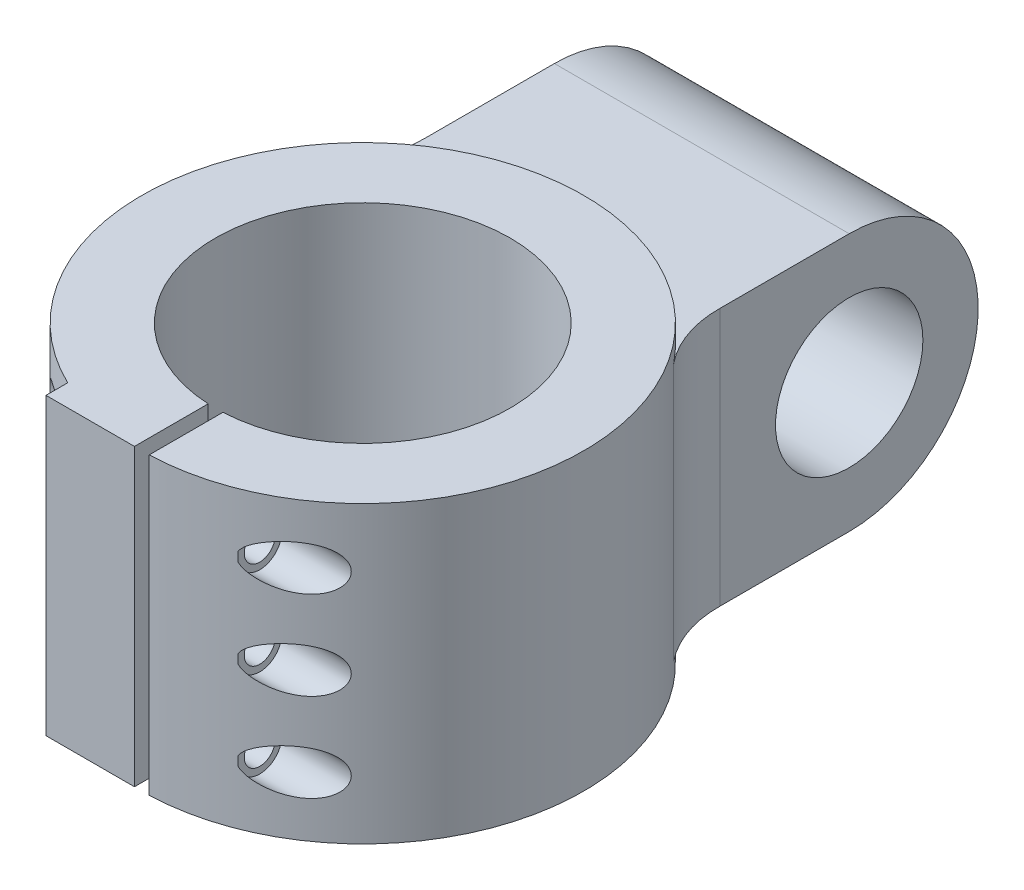
from build123d import *

# Parameters (mm, degrees)
SKETCH1_R                                    = 30
SKETCH1_R_2                                  = 20
BOSS_EXTRUDE1_DEPTH                          = 40
SKETCH2_W                                    = 2
SKETCH2_H                                    = 30
CUT_EXTRUDE1_DEPTH                           = 59.309518948
BOSS_EXTRUDE2_START                          = -40
BOSS_EXTRUDE2_DEPTH                          = 40
CBORE_FOR_M4_HEX_SOCKET_HEAD_CAP_SCR_2_COUNT = 2
CBORE_FOR_M4_HEX_SOCKET_HEAD_CAP_SCR_2_PITCH = 12
CBORE_FOR_M4_HEX_SOCKET_HEAD_CAP_SCR_3_COUNT = 2
CBORE_FOR_M4_HEX_SOCKET_HEAD_CAP_SCR_3_PITCH = 24
SKETCH6_R                                    = 3.75
CUT_EXTRUDE2_DEPTH                           = 66.946948375
F_5_4_5_4_DIAMETER_HOLE1_D                   = 4.2
SKETCH10_R                                   = 3
CUT_EXTRUDE3_DEPTH                           = 11
BOSS_EXTRUDE4_DEPTH                          = 20
BOSS_EXTRUDE4_DEPTH_BACK                     = 20
SKETCH13_R                                   = 17.5
SKETCH13_R_2                                 = 10
FILLET1_R                                    = 15


with BuildPart() as part:
    # Sketch1 → Boss-Extrude1 (new body)
    with BuildSketch(Plane(origin=(0, 0, 0), x_dir=(1, 0, 0), z_dir=(0, 1, 0))):
        with Locations(Location((0, 0, 0), (0, 0, 270))):
            Circle(SKETCH1_R)
        with Locations(Location((0, 0, 0), (0, 0, 270))):
            Circle(SKETCH1_R_2, mode=Mode.SUBTRACT)
    extrude(amount=BOSS_EXTRUDE1_DEPTH)

    # Sketch2 → Cut-Extrude1 (cut, through all)
    with BuildSketch(Plane(origin=(0, 40, 0), x_dir=(1, 0, 0), z_dir=(0, 1, 0))):
        with Locations((0, -15)):
            Rectangle(SKETCH2_W, SKETCH2_H)
    extrude(amount=-CUT_EXTRUDE1_DEPTH, mode=Mode.SUBTRACT)

    # Sketch3 → Boss-Extrude2 (add)
    with BuildSketch(Plane(origin=(0, 40, 0), x_dir=(1, 0, 0), z_dir=(0, 1, 0)).offset(BOSS_EXTRUDE2_START)):
        with BuildLine():
            Line((-1, -29.983328701), (-13, -29.983328701))
            Line((-13, -29.983328701), (-13, -27.037011669))
            ThreePointArc((-13, -27.037011669), (-7.153334608, -29.134683866), (-1, -29.983328701))
        make_face()
    extrude(amount=BOSS_EXTRUDE2_DEPTH)

    # Sketch5 → CBORE for M4 Hex Socket Head Cap Screw1 (revolve, cut)
    with BuildSketch(Plane(origin=(-13, 32, 24.979156528), x_dir=(0, 0, 1), z_dir=(0, 1, 0))):
        Polygon((0, 0), (0, 13.351936393), (2.25, 12), (2.25, 4), (3.75, 4), (3.75, 0), align=None)
    cbore_for_m4_hex_socket_head_cap_screw1 = revolve(axis=Axis((-19.35, 32, 24.979156528), (1, 0, 0)), mode=Mode.SUBTRACT)

    # CBORE for M4 Hex Socket Head Cap Scr 2: CBORE for M4 Hex Socket Head Cap Screw1 ×2
    with Locations(*[(0, -i * CBORE_FOR_M4_HEX_SOCKET_HEAD_CAP_SCR_2_PITCH, 0) for i in range(1, CBORE_FOR_M4_HEX_SOCKET_HEAD_CAP_SCR_2_COUNT)]):
        add(cbore_for_m4_hex_socket_head_cap_screw1, mode=Mode.SUBTRACT)

    # CBORE for M4 Hex Socket Head Cap Scr 3: CBORE for M4 Hex Socket Head Cap Screw1 ×2
    with Locations(*[(0, -i * CBORE_FOR_M4_HEX_SOCKET_HEAD_CAP_SCR_3_PITCH, 0) for i in range(1, CBORE_FOR_M4_HEX_SOCKET_HEAD_CAP_SCR_3_COUNT)]):
        add(cbore_for_m4_hex_socket_head_cap_screw1, mode=Mode.SUBTRACT)

    # Sketch6 → Cut-Extrude2 (cut, through all)
    with BuildSketch(Plane.ZY.offset(13)):
        with Locations((24.979156528, 32)):
            Circle(SKETCH6_R)
        with Locations((24.979156528, 20)):
            Circle(SKETCH6_R)
        with Locations((24.979156528, 8)):
            Circle(SKETCH6_R)
    extrude(amount=CUT_EXTRUDE2_DEPTH, mode=Mode.SUBTRACT)

    # Ø5.4 (5.4) Diameter Hole1 (through all)
    with Locations(Plane.ZY.offset(-1)):
        with Locations((24.979156528, 8), (24.979156528, 20), (24.979156528, 32)):
            Hole(F_5_4_5_4_DIAMETER_HOLE1_D / 2)

    # Sketch10 → Cut-Extrude3 (cut)
    with BuildSketch(Plane.ZY.offset(-22)):
        with Locations((24.979156528, 8)):
            Circle(SKETCH10_R)
        with Locations((24.979156528, 32)):
            Circle(SKETCH10_R)
        with Locations((24.979156528, 20)):
            Circle(SKETCH10_R)
    extrude(amount=CUT_EXTRUDE3_DEPTH, mode=Mode.SUBTRACT)

    # Sketch13 → Boss-Extrude4 (add, two sides: drawn at the far end of the back side and taken through both)
    # profile 1 of 3: a face of its own
    with BuildSketch(Plane(origin=(0, 0, 0), x_dir=(0, 0, -1), z_dir=(1, 0, 0)).offset(-BOSS_EXTRUDE4_DEPTH_BACK)):
        with BuildLine():
            ThreePointArc((28.5, 20), (33.625631329, 32.374368671), (46, 37.5))
            Line((46, 37.5), (30, 37.5))
            Line((30, 37.5), (28.5, 37.5))
            Line((28.5, 37.5), (28.5, 20))
        make_face()
    # profile 2 of 3: a face of its own
    with BuildSketch(Plane(origin=(0, 0, 0), x_dir=(0, 0, -1), z_dir=(1, 0, 0)).offset(-BOSS_EXTRUDE4_DEPTH_BACK)):
        with BuildLine():
            ThreePointArc((46, 2.5), (33.625631329, 7.625631329), (28.5, 20))
            Line((28.5, 20), (28.5, 2.5))
            Line((28.5, 2.5), (30, 2.5))
            Line((30, 2.5), (46, 2.5))
        make_face()
    # profile 3 of 3: a face of its own
    with BuildSketch(Plane(origin=(0, 0, 0), x_dir=(0, 0, -1), z_dir=(1, 0, 0)).offset(-BOSS_EXTRUDE4_DEPTH_BACK)):
        with Locations((46, 20)):
            Circle(SKETCH13_R)
        with Locations((46, 20)):
            Circle(SKETCH13_R_2, mode=Mode.SUBTRACT)
    extrude(amount=BOSS_EXTRUDE4_DEPTH + BOSS_EXTRUDE4_DEPTH_BACK)

    # Fillet1
    # the kernel refuses this fillet: 15 mm, written as the material it adds along each edge
    with BuildSketch(Plane(origin=(9.367496998, 37.5, -28.5), x_dir=(0.8228917781054501, 0, 0.5681981357998729), z_dir=(0, -1, 0))) as fillet1_piece_1:
        with BuildLine():
            CenterArc((21.213026524, -14.387505004), FILLET1_R, 106.429799285, 39.762375137)
            Line((8.749399301, -6.041368385), (0, 0))
            ThreePointArc((0, 0), (8.48521061, -1.224989993), (16.970421219, 0))
        make_face()
    extrude(amount=35)
    with BuildSketch(Plane(origin=(-9.367496998, 37.5, -28.5), x_dir=(-0.8228917781054502, 0, 0.5681981357998726), z_dir=(0, -1, 0))) as fillet1_piece_2:
        with BuildLine():
            CenterArc((21.213026524, 14.387505004), FILLET1_R, 213.807825578, 39.762375137)
            Line((8.749399301, 6.041368385), (0, 0))
            ThreePointArc((0, 0), (8.48521061, 1.224989993), (16.970421219, 0))
        make_face()
    extrude(amount=35)


solid = part.part
